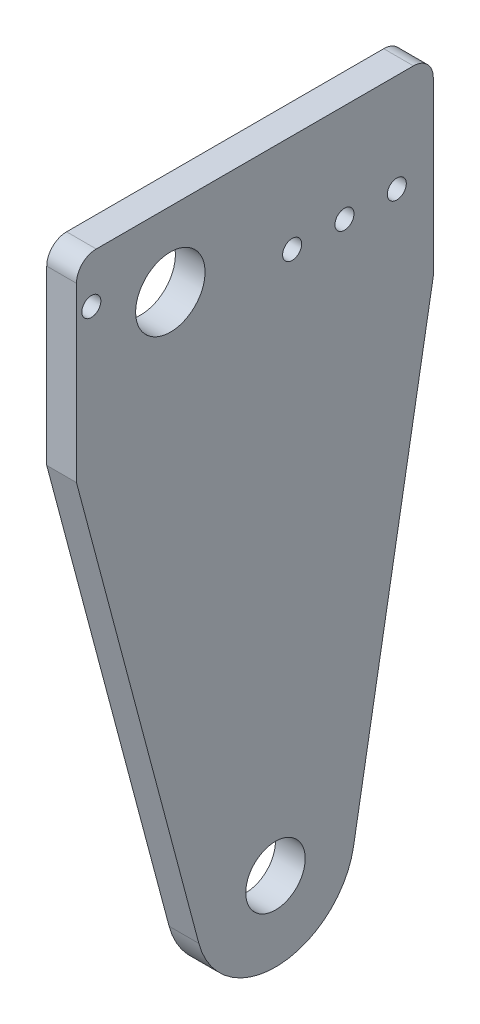
from build123d import *

# Parameters (mm, degrees)
SKETCH1_R           = 4.7625
SKETCH1_R_2         = 5.5626
SKETCH1_R_3         = 1.524
BOSS_EXTRUDE1_DEPTH = 4.7625


with BuildPart() as part:
    # Sketch1 → Boss-Extrude1 (new body)
    with BuildSketch(Plane(origin=(0, 0, 0), x_dir=(0, 0, -1), z_dir=(1, 0, 0))):
        with BuildLine():
            Line((42.1132, 8.7376), (42.1132, -18.894289209))
            Line((42.1132, -18.894289209), (29.346209211, -91.564366891))
            ThreePointArc((29.346209211, -91.564366891), (17.383132621, -102.055117639), (4.564033345, -92.629527657))
            Line((4.564033345, -92.629527657), (-15.0368, -18.894289209))
            Line((-15.0368, -18.894289209), (-15.0368, 8.7376))
            ThreePointArc((-15.0368, 8.7376), (-14.10686403, 10.98266403), (-11.8618, 11.9126))
            Line((-11.8618, 11.9126), (38.9382, 11.9126))
            ThreePointArc((38.9382, 11.9126), (41.18326403, 10.98266403), (42.1132, 8.7376))
        make_face()
        with Locations((16.837778413, -89.366832144)):
            Circle(SKETCH1_R, mode=Mode.SUBTRACT)
        Circle(SKETCH1_R_2, mode=Mode.SUBTRACT)
        with Locations((-12.65555, 4.3307)):
            Circle(SKETCH1_R_3, mode=Mode.SUBTRACT)
        with Locations((36.2712, -3.8354)):
            Circle(SKETCH1_R_3, mode=Mode.SUBTRACT)
        with Locations((27.8892, -3.8354)):
            Circle(SKETCH1_R_3, mode=Mode.SUBTRACT)
        with Locations((19.5072, -3.8354)):
            Circle(SKETCH1_R_3, mode=Mode.SUBTRACT)
    extrude(amount=BOSS_EXTRUDE1_DEPTH)


solid = part.part
